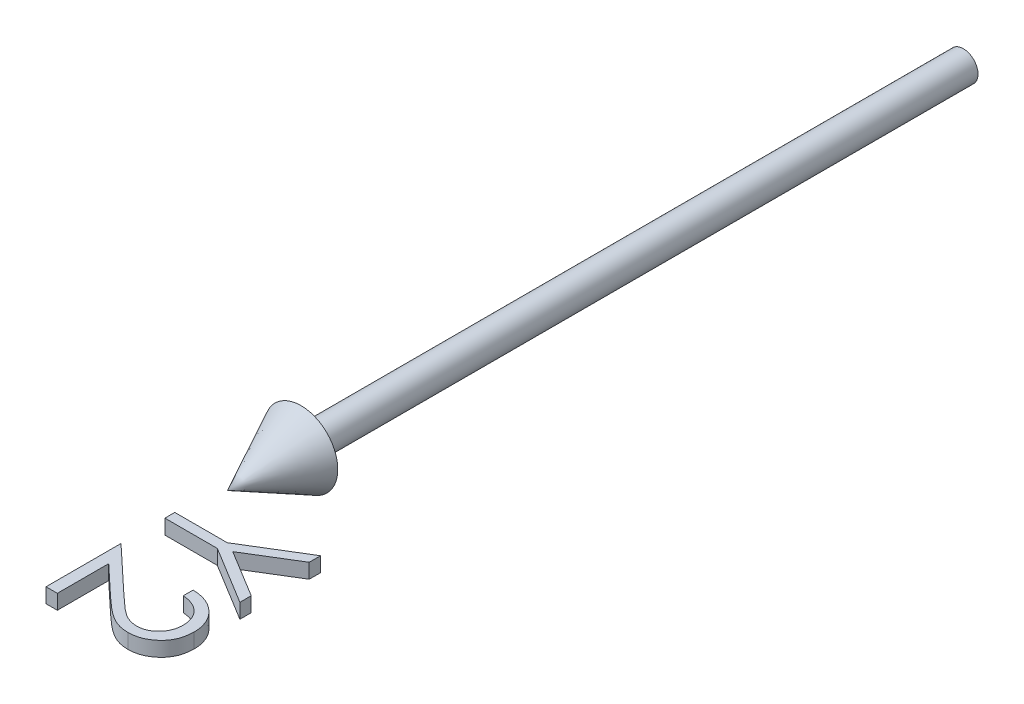
from build123d import *

# Parameters (mm, degrees)
BOSS_EXTRUDE1_DEPTH        = 1
BOSS_EXTRUDE1_DEPTH_BACK   = 1
BOSS_EXTRUDE1_2_DEPTH      = 1
BOSS_EXTRUDE1_2_DEPTH_BACK = 1


with BuildPart() as part:
    # Sketch2 → Revolve1 (revolve)
    with BuildSketch(Plane(origin=(0, 0, 0), x_dir=(1, 0, 0), z_dir=(0, 1, 0))):
        Polygon((0, -100), (5, -90), (2, -90), (2, 0), (0, 0), align=None)
    revolve(axis=Axis((0, 0, -41.949952025), (0, 0, 1)))


with BuildPart() as body_2:
    # Sketch3 → Boss-Extrude1 (new, two sides: drawn at the far end of the back side and taken through both)
    with BuildSketch(Plane(origin=(0, 0, 0), x_dir=(1, 0, 0), z_dir=(0, 1, 0)).offset(-BOSS_EXTRUDE1_DEPTH_BACK)):
        Polygon((15, -102.339799406), (15, -103.881265752), (8.5546875, -107.823573444), (15, -111.759871521), (15, -113.301337867), (7.130408654, -108.49364556), (0, -108.49364556), (0, -107.147491713), (7.130408654, -107.147491713), align=None)
    extrude(amount=BOSS_EXTRUDE1_DEPTH + BOSS_EXTRUDE1_DEPTH_BACK)


with BuildPart() as body_3:
    # Sketch3 → Boss-Extrude1 2 (new, two sides: drawn at the far end of the back side and taken through both)
    with BuildSketch(Plane(origin=(0, 0, 0), x_dir=(1, 0, 0), z_dir=(0, 1, 0)).offset(-BOSS_EXTRUDE1_2_DEPTH_BACK)):
        with BuildLine():
            Line((10.384615385, -116.378260944), (10.384615385, -115.032107098))
            add(Edge.make_bspline(
                [(10.384615385, -115.032107098), (10.563205784, -115.040879118), (10.913952575, -115.05810713), (11.425328289, -115.13882093), (11.914179653, -115.254205354), (12.376315664, -115.417732002), (12.817256926, -115.619673122), (13.231148249, -115.866907492), (13.622097454, -116.154164476), (13.982702577, -116.48091709), (14.312340745, -116.835473791), (14.600012522, -117.215710233), (14.840286171, -117.617718304), (15.042241714, -118.038011158), (15.193649809, -118.481449607), (15.306041475, -118.943794874), (15.373650782, -119.427136713), (15.380918932, -119.756450723), (15.384615385, -119.923934021)],
                knots=[0, 0, 0, 0, 1.100776268, 2.161895295, 3.184016182, 4.190939212, 5.176500551, 6.166955529, 7.155448256, 8.160289653, 9.16017456, 10.133824356, 11.091467644, 12.04088621, 13.000931625, 13.972173743, 14.968683325, 16, 16, 16, 16], degree=3))
            add(Edge.make_bspline(
                [(15.384615385, -119.923934021), (15.380764857, -120.088411482), (15.373198708, -120.411603816), (15.308222868, -120.883298163), (15.206456047, -121.332343711), (15.063675691, -121.757862711), (14.871742431, -122.15646013), (14.641181551, -122.531130321), (14.374525131, -122.886333796), (14.060580216, -123.206077154), (13.72542714, -123.499683208), (13.367621838, -123.752978587), (12.998067757, -123.969892145), (12.613946893, -124.150696487), (12.211642485, -124.283794226), (11.797011616, -124.384843689), (11.365762426, -124.441961176), (11.073877188, -124.450727277), (10.925480769, -124.455184021)],
                knots=[0, 0, 0, 0, 1.111607364, 2.184268762, 3.212621178, 4.221274766, 5.211760367, 6.196651075, 7.1921475, 8.207485113, 9.220403448, 10.201281604, 11.166441695, 12.114753415, 13.065576456, 14.026450734, 14.996634279, 16, 16, 16, 16], degree=3))
            add(Edge.make_bspline(
                [(10.925480769, -124.455184021), (10.716561478, -124.44792718), (10.302389134, -124.433540846), (9.693754008, -124.310479232), (9.104067926, -124.118279899), (8.629479489, -123.886862655), (8.24705023, -123.653409324), (7.932184351, -123.443034291), (7.593160915, -123.196756529), (7.231115184, -122.910991538), (6.843211305, -122.591650658), (6.42968361, -122.235841386), (5.994804597, -121.841026463), (5.697780591, -121.563918603), (5.543870192, -121.420328252)],
                knots=[0, 0, 0, 0, 1.184426356, 2.348067706, 3.509069118, 4.696110526, 5.333549288, 6.050745305, 6.844228056, 7.710549037, 8.667450064, 9.695053472, 10.805634456, 12, 12, 12, 12], degree=3))
            Line((5.543870192, -121.420328252), (1.538461538, -117.667323444))
            Line((1.538461538, -117.667323444), (1.538461538, -124.647491713))
            Line((1.538461538, -124.647491713), (0, -124.647491713))
            Line((0, -124.647491713), (0, -114.455184021))
            Line((0, -114.455184021), (6.207932692, -120.272491713))
            add(Edge.make_bspline(
                [(6.207932692, -120.272491713), (6.355774514, -120.414135542), (6.639748395, -120.686204347), (7.054467176, -121.070854892), (7.438755758, -121.416888647), (7.794317016, -121.724535152), (8.119135251, -121.994047541), (8.415755986, -122.224563491), (8.681633708, -122.417101843), (8.993975739, -122.621152373), (9.37577944, -122.815728095), (9.840016559, -122.986740244), (10.318969101, -123.090268673), (10.642533031, -123.102751304), (10.805288462, -123.109030175)],
                knots=[0, 0, 0, 0, 1.329530082, 2.553755191, 3.672934919, 4.687409497, 5.60679272, 6.413407421, 7.126401618, 7.737995624, 8.834647426, 9.90044882, 10.943907757, 12, 12, 12, 12], degree=3))
            add(Edge.make_bspline(
                [(10.805288462, -123.109030175), (10.907648622, -123.106333552), (11.109380842, -123.101019027), (11.404957531, -123.05322733), (11.691181234, -122.983011841), (11.964512999, -122.874788083), (12.230328736, -122.744761223), (12.480546816, -122.57864232), (12.723696572, -122.388812036), (12.951440602, -122.168618219), (13.160089498, -121.926886322), (13.344903048, -121.6714741), (13.499357413, -121.401261532), (13.625972124, -121.117374714), (13.725295262, -120.820608575), (13.794117725, -120.510388196), (13.837328376, -120.187570995), (13.843174826, -119.967141726), (13.846153846, -119.854823444)],
                knots=[0, 0, 0, 0, 0.991504627, 1.954065223, 2.895985987, 3.842598665, 4.797835564, 5.759220273, 6.74786863, 7.784730864, 8.824135544, 9.839918996, 10.835834653, 11.835434876, 12.84861661, 13.863796685, 14.911511676, 16, 16, 16, 16], degree=3))
            add(Edge.make_bspline(
                [(13.846153846, -119.854823444), (13.843090349, -119.737519355), (13.837074146, -119.507153491), (13.794963866, -119.168936451), (13.722386696, -118.846256232), (13.622884934, -118.538459637), (13.497611426, -118.245250108), (13.338567276, -117.969278843), (13.151962153, -117.708026318), (12.9392425, -117.461972358), (12.701290357, -117.235887375), (12.439301355, -117.033070775), (12.151571288, -116.860089654), (11.84459911, -116.706749676), (11.510222814, -116.589421899), (11.156545105, -116.489131244), (10.778541069, -116.416277499), (10.518104848, -116.391143601), (10.384615385, -116.378260944)],
                knots=[0, 0, 0, 0, 1.031212865, 2.025131798, 2.990757446, 3.934781266, 4.865570067, 5.788494791, 6.729227313, 7.684356718, 8.643577152, 9.610526866, 10.590658432, 11.59095419, 12.621640561, 13.700587263, 14.82141059, 16, 16, 16, 16], degree=3))
        make_face()
    extrude(amount=BOSS_EXTRUDE1_2_DEPTH + BOSS_EXTRUDE1_2_DEPTH_BACK)


solid = Compound([part.part, body_2.part, body_3.part])
